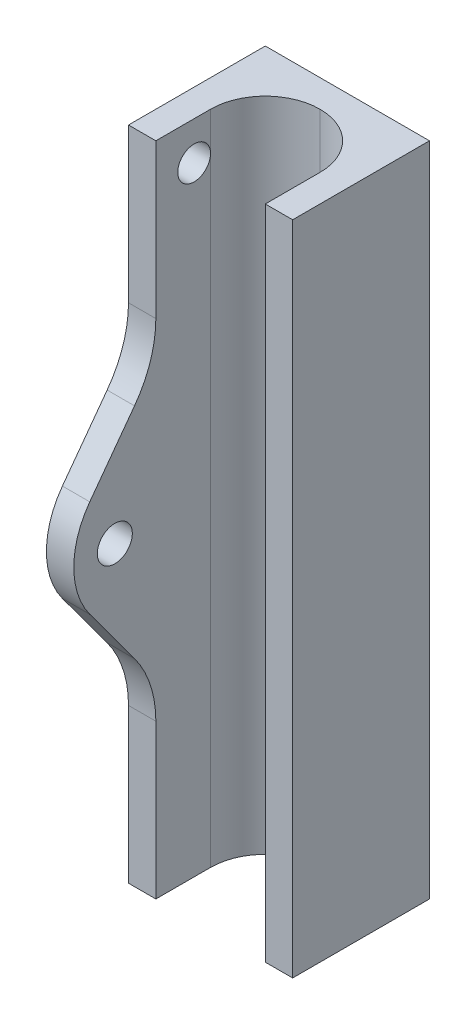
from build123d import *

# Parameters (mm, degrees)
SKETCH1_W               = 3.175
SKETCH1_H               = 76.2
BOSS_EXTRUDE1_DEPTH     = 12.7
BOSS_EXTRUDE1_2_DEPTH   = 12.7
SKETCH1_3_W             = 12.7
SKETCH1_3_H             = 76.2
SKETCH1_3_W_2           = 3.175
BOSS_EXTRUDE2_DEPTH     = 3.175
FILLET1_R               = 6.35
SKETCH2_W               = 3.175
SKETCH2_H               = 76.2
BOSS_EXTRUDE3_DEPTH     = 9.525
CUT_EXTRUDE1_DEPTH      = 47.878313216
CUT_EXTRUDE1_DEPTH_BACK = 47.878313216
SKETCH3_R               = 2.032
SKETCH4_R               = 1.905
CUT_EXTRUDE2_DEPTH      = 3.175


with BuildPart() as part:
    # Sketch1 → Boss-Extrude1 (new body)
    with BuildSketch(Plane.XY):
        with Locations((-7.9375, 0)):
            Rectangle(SKETCH1_W, SKETCH1_H)
    extrude(amount=BOSS_EXTRUDE1_DEPTH)



with BuildPart() as body_2:
    # Sketch1 → Boss-Extrude1 2 (new body)
    with BuildSketch(Plane.XY):
        with Locations((7.9375, 0)):
            Rectangle(SKETCH1_W, SKETCH1_H)
    extrude(amount=BOSS_EXTRUDE1_2_DEPTH)


with BuildPart() as part_1:
    add(part.part)

    add(body_2.part)  # Boss-Extrude2 merges body 2
    # Sketch1<3> → Boss-Extrude2 (add)
    with BuildSketch(Plane.XY):
        Rectangle(SKETCH1_3_W, SKETCH1_3_H)
        with Locations((7.9375, 0)):
            Rectangle(SKETCH1_3_W_2, SKETCH1_3_H)
        with Locations((-7.9375, 0)):
            Rectangle(SKETCH1_3_W_2, SKETCH1_3_H)
    extrude(amount=-BOSS_EXTRUDE2_DEPTH)

    # Fillet1
    fillet1_edges = [part_1.edges().sort_by_distance(p)[0] for p in [
        (6.35, 0, 0),
        (-6.35, 0, 0),
    ]]
    fillet(fillet1_edges, radius=FILLET1_R - 0.0001)  # a hair under: the kernel refuses the full size

    # Sketch2 → Boss-Extrude3 (add)
    with BuildSketch(Plane.XY.offset(12.7)):
        with Locations((-7.9375, 0)):
            Rectangle(SKETCH2_W, SKETCH2_H)
    extrude(amount=BOSS_EXTRUDE3_DEPTH)

    # Sketch3 → Cut-Extrude1 (cut, two sides: drawn at the far end of the back side and taken through both)
    with BuildSketch(Plane(origin=(-6.35, 0, 0), x_dir=(0, 0, -1), z_dir=(1, 0, 0)).offset(-CUT_EXTRUDE1_DEPTH_BACK)):
        with BuildLine():
            Line((-12.7, 38.1), (-22.225, 38.1))
            Line((-22.225, 38.1), (-22.225, -6.1e-08))
            ThreePointArc((-22.225, -6.1e-08), (-21.749068291, 2.973211742), (-20.368834491, 5.649301068))
            Line((-20.368834491, 5.649301068), (-15.174887346, 12.7))
            ThreePointArc((-15.174887346, 12.7), (-13.334575625, 16.268119062), (-12.7, 20.232401424))
            Line((-12.7, 20.232401424), (-12.7, 38.1))
        make_face()
        with BuildLine():
            ThreePointArc((-20.368834491, -5.649301068), (-21.749068272, -2.973211801), (-22.225, -6.1e-08))
            Line((-22.225, -6.1e-08), (-22.225, -38.1))
            Line((-22.225, -38.1), (-12.7, -38.1))
            Line((-12.7, -38.1), (-12.7, -20.232401424))
            ThreePointArc((-12.7, -20.232401424), (-13.334575625, -16.268119062), (-15.174887346, -12.7))
            Line((-15.174887346, -12.7), (-20.368834491, -5.649301068))
        make_face()
        with Locations((-17.4625, 0)):
            Circle(SKETCH3_R)
    extrude(amount=CUT_EXTRUDE1_DEPTH + CUT_EXTRUDE1_DEPTH_BACK, mode=Mode.SUBTRACT)

    # Sketch4 → Cut-Extrude2 (cut)
    with BuildSketch(Plane.ZY.offset(9.525)):
        with Locations(Location((8.255, 33.655, 0), (0, 0, 270))):
            Circle(SKETCH4_R)
    extrude(amount=-CUT_EXTRUDE2_DEPTH, mode=Mode.SUBTRACT)


solid = part_1.part
